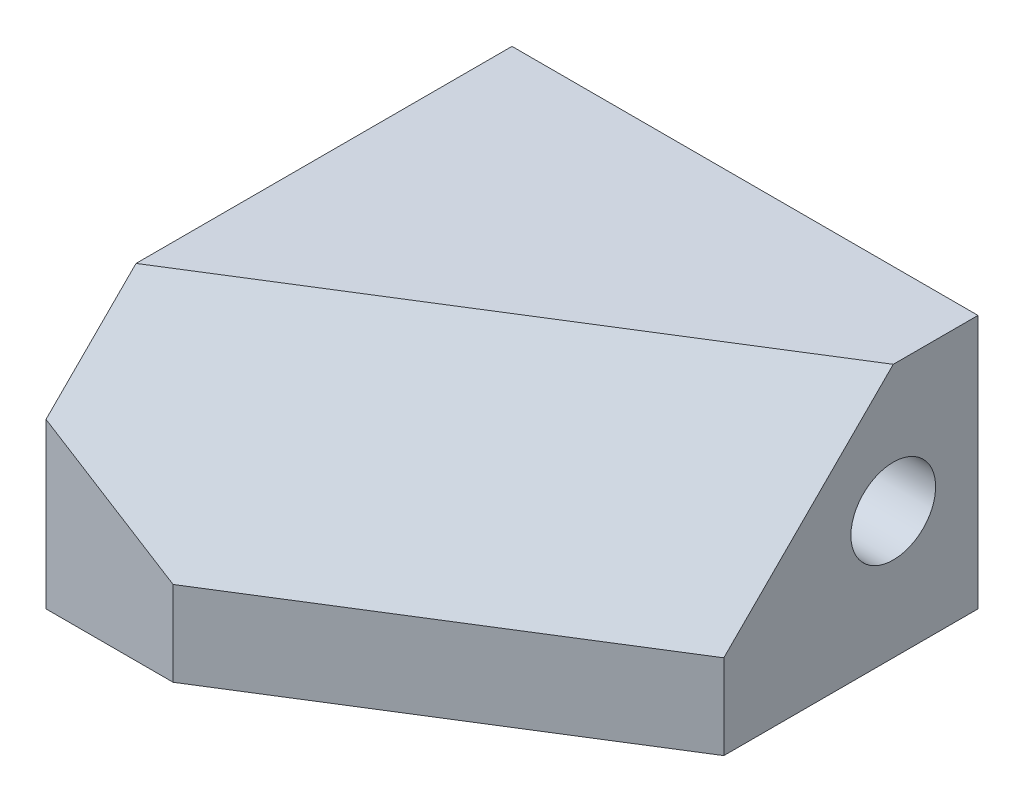
from build123d import *

# Parameters (mm, degrees)
BOSS_EXTRUDE1_DEPTH = 30
INTERSECT1_START    = -64
INTERSECT1_DEPTH    = 64
HOLE1_D             = 10
HOLE1_CBORE_D       = 15
HOLE1_CBORE_DEPTH   = 10


with BuildPart() as part:
    # Sketch2 → Boss-Extrude1 (new body)
    with BuildSketch(Plane(origin=(0, 0, 0), x_dir=(1, 0, 0), z_dir=(0, 1, 0))):
        Polygon((0, 10), (0, 0), (0, -20), (-40, -45), (-55, -45), (-55, 10), align=None)
    extrude(amount=BOSS_EXTRUDE1_DEPTH)

    # Intersect1: read off the stored shape, not the designer's step
    # Intersect1 outline → Intersect1 (cut)
    with BuildSketch(Plane(origin=(0, 0, 0), x_dir=(0.5299989400031803, 0.8479983040050878, 0), z_dir=(0.8479983040050877, -0.5299989400031807, 0)).offset(INTERSECT1_START)):
        Polygon((-12.71997456, 45), (26.287947424, -1), (27, -1), (27, 45), align=None)
    extrude(amount=INTERSECT1_DEPTH, mode=Mode.SUBTRACT)

    # Hole1 (through all)
    with Locations(Plane.ZY.offset(55)):
        with Locations((0, 15)):
            CounterBoreHole(HOLE1_D / 2, HOLE1_CBORE_D / 2, HOLE1_CBORE_DEPTH)


solid = part.part
